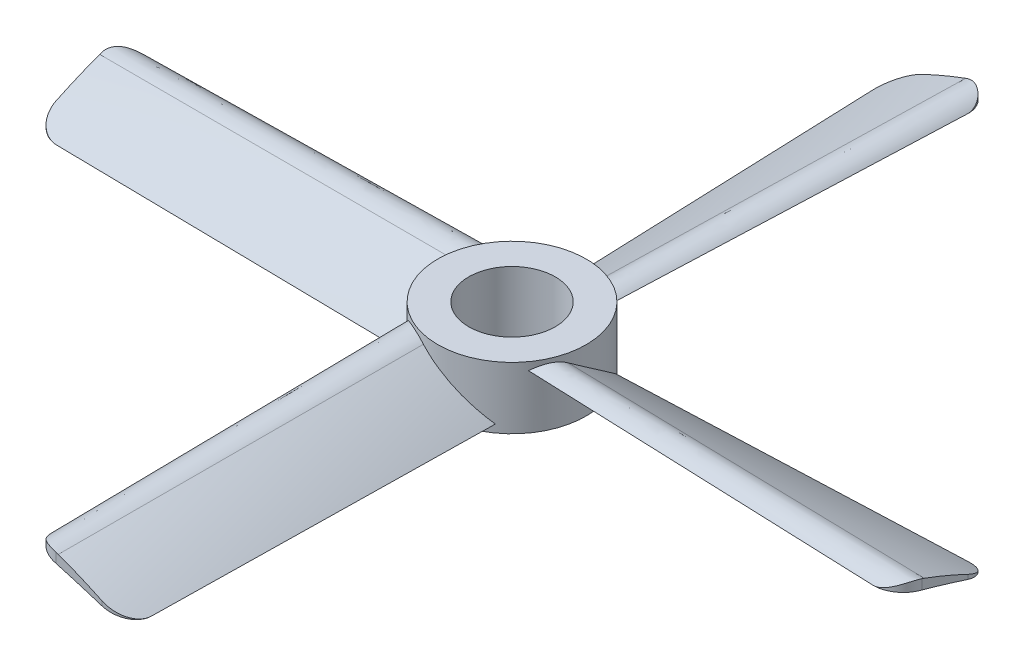
from build123d import *

# Parameters (mm, degrees)
SKETCH_1_R               = 6
EXTRUDE_1_DEPTH          = 5
CUT_EXTRUDE_1_DEPTH      = 36.860842282
PATTERN_CIRCULAR_1_COUNT = 4
SKETCH_6_R               = 3.5
CUT_EXTRUDE_2_DEPTH      = 50.749372006


with BuildPart() as part:
    # 草图1 → 凸台-拉伸1 (new body)
    with BuildSketch(Plane(origin=(0, 0, 0), x_dir=(1, 0, 0), z_dir=(0, 1, 0))):
        Circle(SKETCH_1_R)
    extrude(amount=EXTRUDE_1_DEPTH)

    # 草图2 for 放样1 → 放样1 section 0
    with BuildSketch(Plane.XY.offset(35)):
        with BuildLine():
            # circular arc as an exact rational Bezier (weights 1, cos(half-angle), 1)
            Bezier((-3.863703305, 3.53527618), (-2.919485721, 4.49789499), (-1.673032607, 3.983563916), weights=[1, 0.829156198, 1])
            Bezier((-1.673032607, 3.983563916), (1.191372773, 2.935246532), (3.863703305, 1.46472382), weights=[1, 0.997105185, 1])
            Bezier((3.863703305, 1.46472382), (1.025229649, 2.447997834), (-1.867146891, 3.259119547), weights=[1, 0.999549117, 1])
            Bezier((-1.867146891, 3.259119547), (-2.853787915, 3.481332339), (-3.863703305, 3.53527618), weights=[1, 0.996467284, 1])
        make_face()
    # 草图3 for 放样1 → 放样1 section 1
    with BuildSketch(Plane.XY):
        with BuildLine():
            Bezier((-3.464101615, 4.5), (-2.302913384, 5.185436876), (-1.232050808, 4.366025404), weights=[1, 0.829156198, 1])
            Bezier((-1.232050808, 4.366025404), (1.263427822, 2.612065903), (3.464101615, 0.5), weights=[1, 0.997105185, 1])
            Bezier((3.464101615, 0.5), (0.976836645, 2.184420806), (-1.607050808, 3.716506351), weights=[1, 0.999549117, 1])
            Bezier((-1.607050808, 3.716506351), (-2.502559951, 4.186508913), (-3.464101615, 4.5), weights=[1, 0.996467284, 1])
        make_face()
    loft_1 = loft()

    # 草图5 → 切除-拉伸1 (cut, through all)
    with BuildSketch(Plane(origin=(0, 0, 0), x_dir=(1, 0, 0), z_dir=(0, 1, 0))):
        with BuildLine():
            Line((-3.840608235, -32.977167106), (-3.519580883, -4.859274679))
            Line((-3.519580883, -4.859274679), (-4.519580883, -4.859274679))
            Line((-4.519580883, -4.859274679), (-4.519580883, -35.859274679))
            Line((-4.519580883, -35.859274679), (4.519580883, -35.859274679))
            Line((4.519580883, -35.859274679), (4.519580883, -4.859274679))
            Line((4.519580883, -4.859274679), (3.519580883, -4.859274679))
            Line((3.519580883, -4.859274679), (3.840608235, -32.977167106))
            ThreePointArc((3.840608235, -32.977167106), (3.263001875, -34.406117743), (1.840738575, -35))
            Line((1.840738575, -35), (-1.840738575, -35))
            ThreePointArc((-1.840738575, -35), (-3.263001875, -34.406117743), (-3.840608235, -32.977167106))
        make_face()
    cut_extrude_1 = extrude(amount=CUT_EXTRUDE_1_DEPTH, mode=Mode.SUBTRACT)

    # 阵列(圆周)1: 放样1, 切除-拉伸1 ×4 about axis
    pattern_circular_1_axis = Axis((0, 5, 0), (0, -1, 0))
    add([loft_1.rotate(pattern_circular_1_axis, i * 360 / PATTERN_CIRCULAR_1_COUNT) for i in range(1, PATTERN_CIRCULAR_1_COUNT)])
    add([cut_extrude_1.rotate(pattern_circular_1_axis, i * 360 / PATTERN_CIRCULAR_1_COUNT) for i in range(1, PATTERN_CIRCULAR_1_COUNT)], mode=Mode.SUBTRACT)

    # 草图6 → 切除-拉伸2 (cut, through all)
    with BuildSketch(Plane(origin=(0, 5, 0), x_dir=(1, 0, 0), z_dir=(0, 1, 0))):
        Circle(SKETCH_6_R)
    extrude(amount=-CUT_EXTRUDE_2_DEPTH, mode=Mode.SUBTRACT)


solid = part.part
